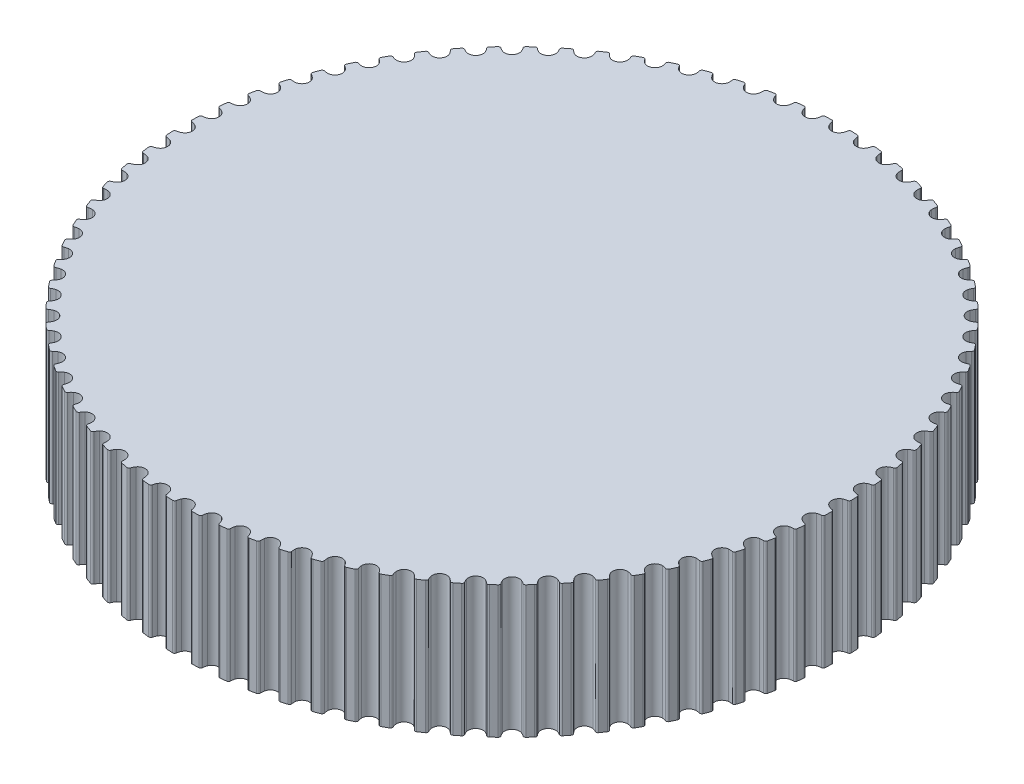
from build123d import *

# Parameters (mm, degrees)
BOSS_EXTRUDE1_DEPTH = 10
FILLET1_R           = 0.15
CIRPATTERN1_DEPTH   = 10


# Read off the part's stored shape, not the designer's step: CirPattern1
with BuildPart() as part:
    # Sketch1 → Boss-Extrude1 (new body)
    with BuildSketch(Plane(origin=(0, 0, 0), x_dir=(1, 0, 0), z_dir=(0, 1, 0))):
        with BuildLine():
            ThreePointArc((0.598433278, 24.949324036), (0.573292963, 24.73041549), (0.500820677, 24.522327156))
            ThreePointArc((0.500820677, 24.522327156), (-3.2e-08, 24.2065), (-0.500820704, 24.522327213))
            ThreePointArc((-0.500820704, 24.522327213), (-0.57329297, 24.730415521), (-0.598433278, 24.949324036))
            ThreePointArc((-0.598433278, 24.949324036), (0, -24.9565), (0.598433278, 24.949324036))
        make_face()
    extrude(amount=BOSS_EXTRUDE1_DEPTH)

    # Fillet1
    fillet1_edges = [part.edges().sort_by_distance(p)[0] for p in [
        (0.598433278, 5, -24.949324036),
        (-0.598433278, 5, -24.949324036),
    ]]
    fillet(fillet1_edges, radius=FILLET1_R)

    # CirPattern1 outline → CirPattern1 (cut)
    with BuildSketch(Plane(origin=(0, 0, 0), x_dir=(1, 0, 0), z_dir=(0, 1, 0))):
        with BuildLine():
            ThreePointArc((-1.217454276, 24.926786743), (-1.958064423, 24.879567439), (-2.696943156, 24.810348443))
            ThreePointArc((-2.696943156, 24.810348443), (-2.593188828, 24.783029865), (-2.53422328, 24.693395444))
            ThreePointArc((-2.53422328, 24.693395444), (-2.489778848, 24.546138198), (-2.423276455, 24.407439115))
            ThreePointArc((-2.423276455, 24.407439115), (-1.899220101, 24.131879439), (-1.42472278, 24.486026993))
            ThreePointArc((-1.42472278, 24.486026993), (-1.380736459, 24.633421727), (-1.35987532, 24.785818632))
            ThreePointArc((-1.35987532, 24.785818632), (-1.315657649, 24.883573749), (-1.217454276, 24.926786743))
        make_face()
        with BuildLine():
            ThreePointArc((-3.169434418, 24.754425417), (-3.904056726, 24.649244072), (-4.635226883, 24.522266698))
            ThreePointArc((-4.635226883, 24.522266698), (-4.529649004, 24.503172804), (-4.463832592, 24.41844108))
            ThreePointArc((-4.463832592, 24.41844108), (-4.407971497, 24.275124849), (-4.330791905, 24.142071046))
            ThreePointArc((-4.330791905, 24.142071046), (-3.786730878, 23.908477817), (-3.341482371, 24.298762283))
            ThreePointArc((-3.341482371, 24.298762283), (-3.309196103, 24.449153775), (-3.300356195, 24.602717637))
            ThreePointArc((-3.300356195, 24.602717637), (-3.26394461, 24.703640686), (-3.169434418, 24.754425417))
        make_face()
        with BuildLine():
            ThreePointArc((-5.101873943, 24.429444826), (-5.825979223, 24.266949918), (-6.544932896, 24.082997024))
            ThreePointArc((-6.544932896, 24.082997024), (-6.438182389, 24.072245535), (-6.365920892, 23.992938906))
            ThreePointArc((-6.365920892, 23.992938906), (-6.298987536, 23.854447283), (-6.211606582, 23.727859082))
            ThreePointArc((-6.211606582, 23.727859082), (-5.6508952, 23.537672478), (-5.237640612, 23.961687623))
            ThreePointArc((-5.237640612, 23.961687623), (-5.217253452, 24.114148659), (-5.220489277, 24.267932707))
            ThreePointArc((-5.220489277, 24.267932707), (-5.192108268, 24.371401464), (-5.101873943, 24.429444826))
        make_face()
        with BuildLine():
            ThreePointArc((-7.002858719, 23.953848585), (-7.71198262, 23.735041949), (-8.414287221, 23.495247664))
            ThreePointArc((-8.414287221, 23.495247664), (-8.307022238, 23.492904867), (-8.228761173, 23.419512286))
            ThreePointArc((-8.228761173, 23.419512286), (-8.151168223, 23.286699117), (-8.054124639, 23.167356975))
            ThreePointArc((-8.054124639, 23.167356975), (-7.480219874, 23.021749562), (-7.101507057, 23.476881191))
            ThreePointArc((-7.101507057, 23.476881191), (-7.093144699, 23.630471799), (-7.108436306, 23.783527902))
            ThreePointArc((-7.108436306, 23.783527902), (-7.088260851, 23.888904447), (-7.002858719, 23.953848585))
        make_face()
        with BuildLine():
            ThreePointArc((-8.860668541, 23.330568901), (-9.55043908, 23.056799553), (-10.231764667, 22.76264229))
            ThreePointArc((-10.231764667, 22.76264229), (-10.124646533, 22.768722629), (-10.040868405, 22.701696585))
            ThreePointArc((-10.040868405, 22.701696585), (-9.953094247, 22.575380707), (-9.846986339, 22.46402041))
            ThreePointArc((-9.846986339, 22.46402041), (-9.263426506, 22.363889904), (-8.92159035, 22.847331979))
            ThreePointArc((-8.92159035, 22.847331979), (-8.92530435, 23.001105222), (-8.952557462, 23.152489738))
            ThreePointArc((-8.952557462, 23.152489738), (-8.940711949, 23.25912439), (-8.860668541, 23.330568901))
        make_face()
        with BuildLine():
            ThreePointArc((-10.663849396, 22.563448502), (-11.330013907, 22.236404321), (-11.986159882, 21.889697657))
            ThreePointArc((-11.986159882, 21.889697657), (-11.879849015, 21.904163644), (-11.791070344, 21.843917375))
            ThreePointArc((-11.791070344, 21.843917375), (-11.693656135, 21.724877568), (-11.579138094, 21.622185688))
            ThreePointArc((-11.579138094, 21.622185688), (-10.989521032, 21.568149428), (-10.686669071, 22.076921368))
            ThreePointArc((-10.686669071, 22.076921368), (-10.702436532, 22.229929182), (-10.741483124, 22.378708776))
            ThreePointArc((-10.741483124, 22.378708776), (-10.738040585, 22.485944097), (-10.663849396, 22.563448502))
        make_face()
        with BuildLine():
            ThreePointArc((-12.401284073, 21.65721694), (-13.03973543, 21.278914262), (-13.666656435, 20.881795759))
            ThreePointArc((-13.666656435, 20.881795759), (-13.561808277, 20.904558207), (-13.468576414, 20.851463151))
            ThreePointArc((-13.468576414, 20.851463151), (-13.362122744, 20.740433335), (-13.239900613, 20.647043001))
            ThreePointArc((-13.239900613, 20.647043001), (-12.647861507, 20.639434138), (-12.385860924, 21.170399196))
            ThreePointArc((-12.385860924, 21.170399196), (-12.413584633, 21.321698237), (-12.46418397, 21.466955632))
            ThreePointArc((-12.46418397, 21.466955632), (-12.46916563, 21.574130482), (-12.401284073, 21.65721694))
        make_face()
        with BuildLine():
            ThreePointArc((-14.06226071, 20.617461434), (-14.669062649, 20.19023262), (-15.262893507, 19.745150646))
            ThreePointArc((-15.262893507, 19.745150646), (-15.160154482, 19.776069216), (-15.063044231, 19.730452723))
            ThreePointArc((-15.063044231, 19.730452723), (-14.948207424, 19.628117433), (-14.819034741, 19.544604429))
            ThreePointArc((-14.819034741, 19.544604429), (-14.22822371, 19.583469874), (-14.008689825, 20.133354472))
            ThreePointArc((-14.008689825, 20.133354472), (-14.048198858, 20.282011931), (-14.110038977, 20.422851569))
            ThreePointArc((-14.110038977, 20.422851569), (-14.123414123, 20.529305178), (-14.06226071, 20.617461434))
        make_face()
        with BuildLine():
            ThreePointArc((-15.636538834, 19.450592421), (-16.207950218, 18.97707148), (-16.765029765, 18.486770114))
            ThreePointArc((-16.765029765, 18.486770114), (-16.665033293, 18.525654183), (-16.564643372, 18.487797493))
            ThreePointArc((-16.564643372, 18.487797493), (-16.442131434, 18.39478766), (-16.306804592, 18.321666871))
            ThreePointArc((-16.306804592, 18.321666871), (-15.720864181, 18.406767006), (-15.545150495, 18.972180924))
            ThreePointArc((-15.545150495, 18.972180924), (-15.596201265, 19.117280279), (-15.668900903, 19.252833835))
            ThreePointArc((-15.668900903, 19.252833835), (-15.690587071, 19.357909881), (-15.636538834, 19.450592421))
        make_face()
        with BuildLine():
            ThreePointArc((-17.114412496, 18.163804039), (-17.646910385, 17.646910385), (-18.163804039, 17.114412496))
            ThreePointArc((-18.163804039, 17.114412496), (-18.067166631, 17.161022332), (-17.964115977, 17.131158843))
            ThreePointArc((-17.964115977, 17.131158843), (-17.834684236, 17.048047905), (-17.694037571, 16.985770144))
            ThreePointArc((-17.694037571, 16.985770144), (-17.116580299, 17.116580299), (-16.985770144, 17.694037571))
            ThreePointArc((-16.985770144, 17.694037571), (-17.048047905, 17.834684236), (-17.131158843, 17.964115977))
            ThreePointArc((-17.131158843, 17.964115977), (-17.161022332, 18.067166631), (-17.114412496, 18.163804039))
        make_face()
        with BuildLine():
            ThreePointArc((-18.486770114, 16.765029765), (-18.97707148, 16.207950218), (-19.450592421, 15.636538834))
            ThreePointArc((-19.450592421, 15.636538834), (-19.357909881, 15.690587071), (-19.252833835, 15.668900903))
            ThreePointArc((-19.252833835, 15.668900903), (-19.117280279, 15.596201265), (-18.972180924, 15.545150495))
            ThreePointArc((-18.972180924, 15.545150495), (-18.406767006, 15.720864181), (-18.321666871, 16.306804592))
            ThreePointArc((-18.321666871, 16.306804592), (-18.39478766, 16.442131434), (-18.487797493, 16.564643372))
            ThreePointArc((-18.487797493, 16.564643372), (-18.525654183, 16.665033293), (-18.486770114, 16.765029765))
        make_face()
        with BuildLine():
            ThreePointArc((-19.745150646, 15.262893507), (-20.19023262, 14.669062649), (-20.617461434, 14.06226071))
            ThreePointArc((-20.617461434, 14.06226071), (-20.529305178, 14.123414123), (-20.422851569, 14.110038977))
            ThreePointArc((-20.422851569, 14.110038977), (-20.282011931, 14.048198858), (-20.133354472, 14.008689825))
            ThreePointArc((-20.133354472, 14.008689825), (-19.583469874, 14.22822371), (-19.544604429, 14.819034741))
            ThreePointArc((-19.544604429, 14.819034741), (-19.628117433, 14.948207424), (-19.730452723, 15.063044231))
            ThreePointArc((-19.730452723, 15.063044231), (-19.776069216, 15.160154482), (-19.745150646, 15.262893507))
        make_face()
        with BuildLine():
            ThreePointArc((-20.881795759, 13.666656435), (-21.278914262, 13.03973543), (-21.65721694, 12.401284073))
            ThreePointArc((-21.65721694, 12.401284073), (-21.574130482, 12.46916563), (-21.466955632, 12.46418397))
            ThreePointArc((-21.466955632, 12.46418397), (-21.321698237, 12.413584633), (-21.170399196, 12.385860924))
            ThreePointArc((-21.170399196, 12.385860924), (-20.639434138, 12.647861507), (-20.647043001, 13.239900613))
            ThreePointArc((-20.647043001, 13.239900613), (-20.740433335, 13.362122744), (-20.851463151, 13.468576414))
            ThreePointArc((-20.851463151, 13.468576414), (-20.904558207, 13.561808277), (-20.881795759, 13.666656435))
        make_face()
        with BuildLine():
            ThreePointArc((-21.889697657, 11.986159882), (-22.236404321, 11.330013907), (-22.563448502, 10.663849396))
            ThreePointArc((-22.563448502, 10.663849396), (-22.485944097, 10.738040585), (-22.378708776, 10.741483124))
            ThreePointArc((-22.378708776, 10.741483124), (-22.229929182, 10.702436532), (-22.076921368, 10.686669071))
            ThreePointArc((-22.076921368, 10.686669071), (-21.568149428, 10.989521032), (-21.622185688, 11.579138094))
            ThreePointArc((-21.622185688, 11.579138094), (-21.724877568, 11.693656135), (-21.843917375, 11.791070344))
            ThreePointArc((-21.843917375, 11.791070344), (-21.904163644, 11.879849015), (-21.889697657, 11.986159882))
        make_face()
        with BuildLine():
            ThreePointArc((-22.76264229, 10.231764667), (-23.056799553, 9.55043908), (-23.330568901, 8.860668541))
            ThreePointArc((-23.330568901, 8.860668541), (-23.25912439, 8.940711949), (-23.152489738, 8.952557462))
            ThreePointArc((-23.152489738, 8.952557462), (-23.001105222, 8.92530435), (-22.847331979, 8.92159035))
            ThreePointArc((-22.847331979, 8.92159035), (-22.363889904, 9.263426506), (-22.46402041, 9.846986339))
            ThreePointArc((-22.46402041, 9.846986339), (-22.575380707, 9.953094247), (-22.701696585, 10.040868405))
            ThreePointArc((-22.701696585, 10.040868405), (-22.768722629, 10.124646533), (-22.76264229, 10.231764667))
        make_face()
        with BuildLine():
            ThreePointArc((-23.495247664, 8.414287221), (-23.735041949, 7.71198262), (-23.953848585, 7.002858719))
            ThreePointArc((-23.953848585, 7.002858719), (-23.888904447, 7.088260851), (-23.783527902, 7.108436306))
            ThreePointArc((-23.783527902, 7.108436306), (-23.630471799, 7.093144699), (-23.476881191, 7.101507057))
            ThreePointArc((-23.476881191, 7.101507057), (-23.021749562, 7.480219874), (-23.167356975, 8.054124639))
            ThreePointArc((-23.167356975, 8.054124639), (-23.286699117, 8.151168223), (-23.419512286, 8.228761173))
            ThreePointArc((-23.419512286, 8.228761173), (-23.492904867, 8.307022238), (-23.495247664, 8.414287221))
        make_face()
        with BuildLine():
            ThreePointArc((-24.082997024, 6.544932896), (-24.266949918, 5.825979223), (-24.429444826, 5.101873943))
            ThreePointArc((-24.429444826, 5.101873943), (-24.371401464, 5.192108268), (-24.267932707, 5.220489277))
            ThreePointArc((-24.267932707, 5.220489277), (-24.114148659, 5.217253452), (-23.961687623, 5.237640612))
            ThreePointArc((-23.961687623, 5.237640612), (-23.537672478, 5.6508952), (-23.727859082, 6.211606582))
            ThreePointArc((-23.727859082, 6.211606582), (-23.854447283, 6.298987536), (-23.992938906, 6.365920892))
            ThreePointArc((-23.992938906, 6.365920892), (-24.072245535, 6.438182389), (-24.082997024, 6.544932896))
        make_face()
        with BuildLine():
            ThreePointArc((-24.522266698, 4.635226883), (-24.649244072, 3.904056726), (-24.754425417, 3.169434418))
            ThreePointArc((-24.754425417, 3.169434418), (-24.703640686, 3.26394461), (-24.602717637, 3.300356195))
            ThreePointArc((-24.602717637, 3.300356195), (-24.449153775, 3.309196103), (-24.298762283, 3.341482371))
            ThreePointArc((-24.298762283, 3.341482371), (-23.908477817, 3.786730878), (-24.142071046, 4.330791905))
            ThreePointArc((-24.142071046, 4.330791905), (-24.275124849, 4.407971497), (-24.41844108, 4.463832592))
            ThreePointArc((-24.41844108, 4.463832592), (-24.503172804, 4.529649004), (-24.522266698, 4.635226883))
        make_face()
        with BuildLine():
            ThreePointArc((-24.810348443, 2.696943156), (-24.879567439, 1.958064423), (-24.926786743, 1.217454276))
            ThreePointArc((-24.926786743, 1.217454276), (-24.883573749, 1.315657649), (-24.785818632, 1.35987532))
            ThreePointArc((-24.785818632, 1.35987532), (-24.633421727, 1.380736459), (-24.486026993, 1.42472278))
            ThreePointArc((-24.486026993, 1.42472278), (-24.131879439, 1.899220101), (-24.407439115, 2.423276455))
            ThreePointArc((-24.407439115, 2.423276455), (-24.546138198, 2.489778848), (-24.693395444, 2.53422328))
            ThreePointArc((-24.693395444, 2.53422328), (-24.783029865, 2.593188828), (-24.810348443, 2.696943156))
        make_face()
        with BuildLine():
            ThreePointArc((-24.94546614, 0.742031876), (-24.9565, 0), (-24.94546614, -0.742031876))
            ThreePointArc((-24.94546614, -0.742031876), (-24.910091305, -0.640740779), (-24.816106813, -0.588989638))
            ThreePointArc((-24.816106813, -0.588989638), (-24.665816443, -0.556235884), (-24.522327205, -0.500820701))
            ThreePointArc((-24.522327205, -0.500820701), (-24.2065, 0), (-24.522327205, 0.500820701))
            ThreePointArc((-24.522327205, 0.500820701), (-24.665816443, 0.556235884), (-24.816106813, 0.588989638))
            ThreePointArc((-24.816106813, 0.588989638), (-24.910091305, 0.640740779), (-24.94546614, 0.742031876))
        make_face()
        with BuildLine():
            ThreePointArc((-24.926786743, -1.217454276), (-24.879567439, -1.958064423), (-24.810348443, -2.696943156))
            ThreePointArc((-24.810348443, -2.696943156), (-24.783029865, -2.593188828), (-24.693395444, -2.53422328))
            ThreePointArc((-24.693395444, -2.53422328), (-24.546138198, -2.489778848), (-24.407439115, -2.423276455))
            ThreePointArc((-24.407439115, -2.423276455), (-24.131879439, -1.899220101), (-24.486026993, -1.42472278))
            ThreePointArc((-24.486026993, -1.42472278), (-24.633421727, -1.380736459), (-24.785818632, -1.35987532))
            ThreePointArc((-24.785818632, -1.35987532), (-24.883573749, -1.315657649), (-24.926786743, -1.217454276))
        make_face()
        with BuildLine():
            ThreePointArc((-24.754425417, -3.169434418), (-24.649244072, -3.904056726), (-24.522266698, -4.635226883))
            ThreePointArc((-24.522266698, -4.635226883), (-24.503172804, -4.529649004), (-24.41844108, -4.463832592))
            ThreePointArc((-24.41844108, -4.463832592), (-24.275124849, -4.407971497), (-24.142071046, -4.330791905))
            ThreePointArc((-24.142071046, -4.330791905), (-23.908477817, -3.786730878), (-24.298762283, -3.341482371))
            ThreePointArc((-24.298762283, -3.341482371), (-24.449153775, -3.309196103), (-24.602717637, -3.300356195))
            ThreePointArc((-24.602717637, -3.300356195), (-24.703640686, -3.26394461), (-24.754425417, -3.169434418))
        make_face()
        with BuildLine():
            ThreePointArc((-24.429444826, -5.101873943), (-24.266949918, -5.825979223), (-24.082997024, -6.544932896))
            ThreePointArc((-24.082997024, -6.544932896), (-24.072245535, -6.438182389), (-23.992938906, -6.365920892))
            ThreePointArc((-23.992938906, -6.365920892), (-23.854447283, -6.298987536), (-23.727859082, -6.211606582))
            ThreePointArc((-23.727859082, -6.211606582), (-23.537672478, -5.6508952), (-23.961687623, -5.237640612))
            ThreePointArc((-23.961687623, -5.237640612), (-24.114148659, -5.217253452), (-24.267932707, -5.220489277))
            ThreePointArc((-24.267932707, -5.220489277), (-24.371401464, -5.192108268), (-24.429444826, -5.101873943))
        make_face()
        with BuildLine():
            ThreePointArc((-23.953848585, -7.002858719), (-23.735041949, -7.71198262), (-23.495247664, -8.414287221))
            ThreePointArc((-23.495247664, -8.414287221), (-23.492904867, -8.307022238), (-23.419512286, -8.228761173))
            ThreePointArc((-23.419512286, -8.228761173), (-23.286699117, -8.151168223), (-23.167356975, -8.054124639))
            ThreePointArc((-23.167356975, -8.054124639), (-23.021749562, -7.480219874), (-23.476881191, -7.101507057))
            ThreePointArc((-23.476881191, -7.101507057), (-23.630471799, -7.093144699), (-23.783527902, -7.108436306))
            ThreePointArc((-23.783527902, -7.108436306), (-23.888904447, -7.088260851), (-23.953848585, -7.002858719))
        make_face()
        with BuildLine():
            ThreePointArc((-23.330568901, -8.860668541), (-23.056799553, -9.55043908), (-22.76264229, -10.231764667))
            ThreePointArc((-22.76264229, -10.231764667), (-22.768722629, -10.124646533), (-22.701696585, -10.040868405))
            ThreePointArc((-22.701696585, -10.040868405), (-22.575380707, -9.953094247), (-22.46402041, -9.846986339))
            ThreePointArc((-22.46402041, -9.846986339), (-22.363889904, -9.263426506), (-22.847331979, -8.92159035))
            ThreePointArc((-22.847331979, -8.92159035), (-23.001105222, -8.92530435), (-23.152489738, -8.952557462))
            ThreePointArc((-23.152489738, -8.952557462), (-23.25912439, -8.940711949), (-23.330568901, -8.860668541))
        make_face()
        with BuildLine():
            ThreePointArc((-22.563448502, -10.663849396), (-22.236404321, -11.330013907), (-21.889697657, -11.986159882))
            ThreePointArc((-21.889697657, -11.986159882), (-21.904163644, -11.879849015), (-21.843917375, -11.791070344))
            ThreePointArc((-21.843917375, -11.791070344), (-21.724877568, -11.693656135), (-21.622185688, -11.579138094))
            ThreePointArc((-21.622185688, -11.579138094), (-21.568149428, -10.989521032), (-22.076921368, -10.686669071))
            ThreePointArc((-22.076921368, -10.686669071), (-22.229929182, -10.702436532), (-22.378708776, -10.741483124))
            ThreePointArc((-22.378708776, -10.741483124), (-22.485944097, -10.738040585), (-22.563448502, -10.663849396))
        make_face()
        with BuildLine():
            ThreePointArc((-21.65721694, -12.401284073), (-21.278914262, -13.03973543), (-20.881795759, -13.666656435))
            ThreePointArc((-20.881795759, -13.666656435), (-20.904558207, -13.561808277), (-20.851463151, -13.468576414))
            ThreePointArc((-20.851463151, -13.468576414), (-20.740433335, -13.362122744), (-20.647043001, -13.239900613))
            ThreePointArc((-20.647043001, -13.239900613), (-20.639434138, -12.647861507), (-21.170399196, -12.385860924))
            ThreePointArc((-21.170399196, -12.385860924), (-21.321698237, -12.413584633), (-21.466955632, -12.46418397))
            ThreePointArc((-21.466955632, -12.46418397), (-21.574130482, -12.46916563), (-21.65721694, -12.401284073))
        make_face()
        with BuildLine():
            ThreePointArc((-20.617461434, -14.06226071), (-20.19023262, -14.669062649), (-19.745150646, -15.262893507))
            ThreePointArc((-19.745150646, -15.262893507), (-19.776069216, -15.160154482), (-19.730452723, -15.063044231))
            ThreePointArc((-19.730452723, -15.063044231), (-19.628117433, -14.948207424), (-19.544604429, -14.819034741))
            ThreePointArc((-19.544604429, -14.819034741), (-19.583469874, -14.22822371), (-20.133354472, -14.008689825))
            ThreePointArc((-20.133354472, -14.008689825), (-20.282011931, -14.048198858), (-20.422851569, -14.110038977))
            ThreePointArc((-20.422851569, -14.110038977), (-20.529305178, -14.123414123), (-20.617461434, -14.06226071))
        make_face()
        with BuildLine():
            ThreePointArc((-19.450592421, -15.636538834), (-18.97707148, -16.207950218), (-18.486770114, -16.765029765))
            ThreePointArc((-18.486770114, -16.765029765), (-18.525654183, -16.665033293), (-18.487797493, -16.564643372))
            ThreePointArc((-18.487797493, -16.564643372), (-18.39478766, -16.442131434), (-18.321666871, -16.306804592))
            ThreePointArc((-18.321666871, -16.306804592), (-18.406767006, -15.720864181), (-18.972180924, -15.545150495))
            ThreePointArc((-18.972180924, -15.545150495), (-19.117280279, -15.596201265), (-19.252833835, -15.668900903))
            ThreePointArc((-19.252833835, -15.668900903), (-19.357909881, -15.690587071), (-19.450592421, -15.636538834))
        make_face()
        with BuildLine():
            ThreePointArc((-18.163804039, -17.114412496), (-17.646910385, -17.646910385), (-17.114412496, -18.163804039))
            ThreePointArc((-17.114412496, -18.163804039), (-17.161022332, -18.067166631), (-17.131158843, -17.964115977))
            ThreePointArc((-17.131158843, -17.964115977), (-17.048047905, -17.834684236), (-16.985770144, -17.694037571))
            ThreePointArc((-16.985770144, -17.694037571), (-17.116580299, -17.116580299), (-17.694037571, -16.985770144))
            ThreePointArc((-17.694037571, -16.985770144), (-17.834684236, -17.048047905), (-17.964115977, -17.131158843))
            ThreePointArc((-17.964115977, -17.131158843), (-18.067166631, -17.161022332), (-18.163804039, -17.114412496))
        make_face()
        with BuildLine():
            ThreePointArc((-16.765029765, -18.486770114), (-16.207950218, -18.97707148), (-15.636538834, -19.450592421))
            ThreePointArc((-15.636538834, -19.450592421), (-15.690587071, -19.357909881), (-15.668900903, -19.252833835))
            ThreePointArc((-15.668900903, -19.252833835), (-15.596201265, -19.117280279), (-15.545150495, -18.972180924))
            ThreePointArc((-15.545150495, -18.972180924), (-15.720864181, -18.406767006), (-16.306804592, -18.321666871))
            ThreePointArc((-16.306804592, -18.321666871), (-16.442131434, -18.39478766), (-16.564643372, -18.487797493))
            ThreePointArc((-16.564643372, -18.487797493), (-16.665033293, -18.525654183), (-16.765029765, -18.486770114))
        make_face()
        with BuildLine():
            ThreePointArc((-15.262893507, -19.745150646), (-14.669062649, -20.19023262), (-14.06226071, -20.617461434))
            ThreePointArc((-14.06226071, -20.617461434), (-14.123414123, -20.529305178), (-14.110038977, -20.422851569))
            ThreePointArc((-14.110038977, -20.422851569), (-14.048198858, -20.282011931), (-14.008689825, -20.133354472))
            ThreePointArc((-14.008689825, -20.133354472), (-14.22822371, -19.583469874), (-14.819034741, -19.544604429))
            ThreePointArc((-14.819034741, -19.544604429), (-14.948207424, -19.628117433), (-15.063044231, -19.730452723))
            ThreePointArc((-15.063044231, -19.730452723), (-15.160154482, -19.776069216), (-15.262893507, -19.745150646))
        make_face()
        with BuildLine():
            ThreePointArc((-13.666656435, -20.881795759), (-13.03973543, -21.278914262), (-12.401284073, -21.65721694))
            ThreePointArc((-12.401284073, -21.65721694), (-12.46916563, -21.574130482), (-12.46418397, -21.466955632))
            ThreePointArc((-12.46418397, -21.466955632), (-12.413584633, -21.321698237), (-12.385860924, -21.170399196))
            ThreePointArc((-12.385860924, -21.170399196), (-12.647861507, -20.639434138), (-13.239900613, -20.647043001))
            ThreePointArc((-13.239900613, -20.647043001), (-13.362122744, -20.740433335), (-13.468576414, -20.851463151))
            ThreePointArc((-13.468576414, -20.851463151), (-13.561808277, -20.904558207), (-13.666656435, -20.881795759))
        make_face()
        with BuildLine():
            ThreePointArc((-11.986159882, -21.889697657), (-11.330013907, -22.236404321), (-10.663849396, -22.563448502))
            ThreePointArc((-10.663849396, -22.563448502), (-10.738040585, -22.485944097), (-10.741483124, -22.378708776))
            ThreePointArc((-10.741483124, -22.378708776), (-10.702436532, -22.229929182), (-10.686669071, -22.076921368))
            ThreePointArc((-10.686669071, -22.076921368), (-10.989521032, -21.568149428), (-11.579138094, -21.622185688))
            ThreePointArc((-11.579138094, -21.622185688), (-11.693656135, -21.724877568), (-11.791070344, -21.843917375))
            ThreePointArc((-11.791070344, -21.843917375), (-11.879849015, -21.904163644), (-11.986159882, -21.889697657))
        make_face()
        with BuildLine():
            ThreePointArc((-10.231764667, -22.76264229), (-9.55043908, -23.056799553), (-8.860668541, -23.330568901))
            ThreePointArc((-8.860668541, -23.330568901), (-8.940711949, -23.25912439), (-8.952557462, -23.152489738))
            ThreePointArc((-8.952557462, -23.152489738), (-8.92530435, -23.001105222), (-8.92159035, -22.847331979))
            ThreePointArc((-8.92159035, -22.847331979), (-9.263426506, -22.363889904), (-9.846986339, -22.46402041))
            ThreePointArc((-9.846986339, -22.46402041), (-9.953094247, -22.575380707), (-10.040868405, -22.701696585))
            ThreePointArc((-10.040868405, -22.701696585), (-10.124646533, -22.768722629), (-10.231764667, -22.76264229))
        make_face()
        with BuildLine():
            ThreePointArc((-8.414287221, -23.495247664), (-7.71198262, -23.735041949), (-7.002858719, -23.953848585))
            ThreePointArc((-7.002858719, -23.953848585), (-7.088260851, -23.888904447), (-7.108436306, -23.783527902))
            ThreePointArc((-7.108436306, -23.783527902), (-7.093144699, -23.630471799), (-7.101507057, -23.476881191))
            ThreePointArc((-7.101507057, -23.476881191), (-7.480219874, -23.021749562), (-8.054124639, -23.167356975))
            ThreePointArc((-8.054124639, -23.167356975), (-8.151168223, -23.286699117), (-8.228761173, -23.419512286))
            ThreePointArc((-8.228761173, -23.419512286), (-8.307022238, -23.492904867), (-8.414287221, -23.495247664))
        make_face()
        with BuildLine():
            ThreePointArc((-6.544932896, -24.082997024), (-5.825979223, -24.266949918), (-5.101873943, -24.429444826))
            ThreePointArc((-5.101873943, -24.429444826), (-5.192108268, -24.371401464), (-5.220489277, -24.267932707))
            ThreePointArc((-5.220489277, -24.267932707), (-5.217253452, -24.114148659), (-5.237640612, -23.961687623))
            ThreePointArc((-5.237640612, -23.961687623), (-5.6508952, -23.537672478), (-6.211606582, -23.727859082))
            ThreePointArc((-6.211606582, -23.727859082), (-6.298987536, -23.854447283), (-6.365920892, -23.992938906))
            ThreePointArc((-6.365920892, -23.992938906), (-6.438182389, -24.072245535), (-6.544932896, -24.082997024))
        make_face()
        with BuildLine():
            ThreePointArc((-4.635226883, -24.522266698), (-3.904056726, -24.649244072), (-3.169434418, -24.754425417))
            ThreePointArc((-3.169434418, -24.754425417), (-3.26394461, -24.703640686), (-3.300356195, -24.602717637))
            ThreePointArc((-3.300356195, -24.602717637), (-3.309196103, -24.449153775), (-3.341482371, -24.298762283))
            ThreePointArc((-3.341482371, -24.298762283), (-3.786730878, -23.908477817), (-4.330791905, -24.142071046))
            ThreePointArc((-4.330791905, -24.142071046), (-4.407971497, -24.275124849), (-4.463832592, -24.41844108))
            ThreePointArc((-4.463832592, -24.41844108), (-4.529649004, -24.503172804), (-4.635226883, -24.522266698))
        make_face()
        with BuildLine():
            ThreePointArc((-2.696943156, -24.810348443), (-1.958064423, -24.879567439), (-1.217454276, -24.926786743))
            ThreePointArc((-1.217454276, -24.926786743), (-1.315657649, -24.883573749), (-1.35987532, -24.785818632))
            ThreePointArc((-1.35987532, -24.785818632), (-1.380736459, -24.633421727), (-1.42472278, -24.486026993))
            ThreePointArc((-1.42472278, -24.486026993), (-1.899220101, -24.131879439), (-2.423276455, -24.407439115))
            ThreePointArc((-2.423276455, -24.407439115), (-2.489778848, -24.546138198), (-2.53422328, -24.693395444))
            ThreePointArc((-2.53422328, -24.693395444), (-2.593188828, -24.783029865), (-2.696943156, -24.810348443))
        make_face()
        with BuildLine():
            ThreePointArc((-0.742031876, -24.94546614), (0, -24.9565), (0.742031876, -24.94546614))
            ThreePointArc((0.742031876, -24.94546614), (0.640740779, -24.910091305), (0.588989638, -24.816106813))
            ThreePointArc((0.588989638, -24.816106813), (0.556235884, -24.665816443), (0.500820701, -24.522327205))
            ThreePointArc((0.500820701, -24.522327205), (0, -24.2065), (-0.500820701, -24.522327205))
            ThreePointArc((-0.500820701, -24.522327205), (-0.556235884, -24.665816443), (-0.588989638, -24.816106813))
            ThreePointArc((-0.588989638, -24.816106813), (-0.640740779, -24.910091305), (-0.742031876, -24.94546614))
        make_face()
        with BuildLine():
            ThreePointArc((1.217454276, -24.926786743), (1.958064423, -24.879567439), (2.696943156, -24.810348443))
            ThreePointArc((2.696943156, -24.810348443), (2.593188828, -24.783029865), (2.53422328, -24.693395444))
            ThreePointArc((2.53422328, -24.693395444), (2.489778848, -24.546138198), (2.423276455, -24.407439115))
            ThreePointArc((2.423276455, -24.407439115), (1.899220101, -24.131879439), (1.42472278, -24.486026993))
            ThreePointArc((1.42472278, -24.486026993), (1.380736459, -24.633421727), (1.35987532, -24.785818632))
            ThreePointArc((1.35987532, -24.785818632), (1.315657649, -24.883573749), (1.217454276, -24.926786743))
        make_face()
        with BuildLine():
            ThreePointArc((3.169434418, -24.754425417), (3.904056726, -24.649244072), (4.635226883, -24.522266698))
            ThreePointArc((4.635226883, -24.522266698), (4.529649004, -24.503172804), (4.463832592, -24.41844108))
            ThreePointArc((4.463832592, -24.41844108), (4.407971497, -24.275124849), (4.330791905, -24.142071046))
            ThreePointArc((4.330791905, -24.142071046), (3.786730878, -23.908477817), (3.341482371, -24.298762283))
            ThreePointArc((3.341482371, -24.298762283), (3.309196103, -24.449153775), (3.300356195, -24.602717637))
            ThreePointArc((3.300356195, -24.602717637), (3.26394461, -24.703640686), (3.169434418, -24.754425417))
        make_face()
        with BuildLine():
            ThreePointArc((5.101873943, -24.429444826), (5.825979223, -24.266949918), (6.544932896, -24.082997024))
            ThreePointArc((6.544932896, -24.082997024), (6.438182389, -24.072245535), (6.365920892, -23.992938906))
            ThreePointArc((6.365920892, -23.992938906), (6.298987536, -23.854447283), (6.211606582, -23.727859082))
            ThreePointArc((6.211606582, -23.727859082), (5.6508952, -23.537672478), (5.237640612, -23.961687623))
            ThreePointArc((5.237640612, -23.961687623), (5.217253452, -24.114148659), (5.220489277, -24.267932707))
            ThreePointArc((5.220489277, -24.267932707), (5.192108268, -24.371401464), (5.101873943, -24.429444826))
        make_face()
        with BuildLine():
            ThreePointArc((7.002858719, -23.953848585), (7.71198262, -23.735041949), (8.414287221, -23.495247664))
            ThreePointArc((8.414287221, -23.495247664), (8.307022238, -23.492904867), (8.228761173, -23.419512286))
            ThreePointArc((8.228761173, -23.419512286), (8.151168223, -23.286699117), (8.054124639, -23.167356975))
            ThreePointArc((8.054124639, -23.167356975), (7.480219874, -23.021749562), (7.101507057, -23.476881191))
            ThreePointArc((7.101507057, -23.476881191), (7.093144699, -23.630471799), (7.108436306, -23.783527902))
            ThreePointArc((7.108436306, -23.783527902), (7.088260851, -23.888904447), (7.002858719, -23.953848585))
        make_face()
        with BuildLine():
            ThreePointArc((8.860668541, -23.330568901), (9.55043908, -23.056799553), (10.231764667, -22.76264229))
            ThreePointArc((10.231764667, -22.76264229), (10.124646533, -22.768722629), (10.040868405, -22.701696585))
            ThreePointArc((10.040868405, -22.701696585), (9.953094247, -22.575380707), (9.846986339, -22.46402041))
            ThreePointArc((9.846986339, -22.46402041), (9.263426506, -22.363889904), (8.92159035, -22.847331979))
            ThreePointArc((8.92159035, -22.847331979), (8.92530435, -23.001105222), (8.952557462, -23.152489738))
            ThreePointArc((8.952557462, -23.152489738), (8.940711949, -23.25912439), (8.860668541, -23.330568901))
        make_face()
        with BuildLine():
            ThreePointArc((10.663849396, -22.563448502), (11.330013907, -22.236404321), (11.986159882, -21.889697657))
            ThreePointArc((11.986159882, -21.889697657), (11.879849015, -21.904163644), (11.791070344, -21.843917375))
            ThreePointArc((11.791070344, -21.843917375), (11.693656135, -21.724877568), (11.579138094, -21.622185688))
            ThreePointArc((11.579138094, -21.622185688), (10.989521032, -21.568149428), (10.686669071, -22.076921368))
            ThreePointArc((10.686669071, -22.076921368), (10.702436532, -22.229929182), (10.741483124, -22.378708776))
            ThreePointArc((10.741483124, -22.378708776), (10.738040585, -22.485944097), (10.663849396, -22.563448502))
        make_face()
        with BuildLine():
            ThreePointArc((12.401284073, -21.65721694), (13.03973543, -21.278914262), (13.666656435, -20.881795759))
            ThreePointArc((13.666656435, -20.881795759), (13.561808277, -20.904558207), (13.468576414, -20.851463151))
            ThreePointArc((13.468576414, -20.851463151), (13.362122744, -20.740433335), (13.239900613, -20.647043001))
            ThreePointArc((13.239900613, -20.647043001), (12.647861507, -20.639434138), (12.385860924, -21.170399196))
            ThreePointArc((12.385860924, -21.170399196), (12.413584633, -21.321698237), (12.46418397, -21.466955632))
            ThreePointArc((12.46418397, -21.466955632), (12.46916563, -21.574130482), (12.401284073, -21.65721694))
        make_face()
        with BuildLine():
            ThreePointArc((14.06226071, -20.617461434), (14.669062649, -20.19023262), (15.262893507, -19.745150646))
            ThreePointArc((15.262893507, -19.745150646), (15.160154482, -19.776069216), (15.063044231, -19.730452723))
            ThreePointArc((15.063044231, -19.730452723), (14.948207424, -19.628117433), (14.819034741, -19.544604429))
            ThreePointArc((14.819034741, -19.544604429), (14.22822371, -19.583469874), (14.008689825, -20.133354472))
            ThreePointArc((14.008689825, -20.133354472), (14.048198858, -20.282011931), (14.110038977, -20.422851569))
            ThreePointArc((14.110038977, -20.422851569), (14.123414123, -20.529305178), (14.06226071, -20.617461434))
        make_face()
        with BuildLine():
            ThreePointArc((15.636538834, -19.450592421), (16.207950218, -18.97707148), (16.765029765, -18.486770114))
            ThreePointArc((16.765029765, -18.486770114), (16.665033293, -18.525654183), (16.564643372, -18.487797493))
            ThreePointArc((16.564643372, -18.487797493), (16.442131434, -18.39478766), (16.306804592, -18.321666871))
            ThreePointArc((16.306804592, -18.321666871), (15.720864181, -18.406767006), (15.545150495, -18.972180924))
            ThreePointArc((15.545150495, -18.972180924), (15.596201265, -19.117280279), (15.668900903, -19.252833835))
            ThreePointArc((15.668900903, -19.252833835), (15.690587071, -19.357909881), (15.636538834, -19.450592421))
        make_face()
        with BuildLine():
            ThreePointArc((17.114412496, -18.163804039), (17.646910385, -17.646910385), (18.163804039, -17.114412496))
            ThreePointArc((18.163804039, -17.114412496), (18.067166631, -17.161022332), (17.964115977, -17.131158843))
            ThreePointArc((17.964115977, -17.131158843), (17.834684236, -17.048047905), (17.694037571, -16.985770144))
            ThreePointArc((17.694037571, -16.985770144), (17.116580299, -17.116580299), (16.985770144, -17.694037571))
            ThreePointArc((16.985770144, -17.694037571), (17.048047905, -17.834684236), (17.131158843, -17.964115977))
            ThreePointArc((17.131158843, -17.964115977), (17.161022332, -18.067166631), (17.114412496, -18.163804039))
        make_face()
        with BuildLine():
            ThreePointArc((18.486770114, -16.765029765), (18.97707148, -16.207950218), (19.450592421, -15.636538834))
            ThreePointArc((19.450592421, -15.636538834), (19.357909881, -15.690587071), (19.252833835, -15.668900903))
            ThreePointArc((19.252833835, -15.668900903), (19.117280279, -15.596201265), (18.972180924, -15.545150495))
            ThreePointArc((18.972180924, -15.545150495), (18.406767006, -15.720864181), (18.321666871, -16.306804592))
            ThreePointArc((18.321666871, -16.306804592), (18.39478766, -16.442131434), (18.487797493, -16.564643372))
            ThreePointArc((18.487797493, -16.564643372), (18.525654183, -16.665033293), (18.486770114, -16.765029765))
        make_face()
        with BuildLine():
            ThreePointArc((19.745150646, -15.262893507), (20.19023262, -14.669062649), (20.617461434, -14.06226071))
            ThreePointArc((20.617461434, -14.06226071), (20.529305178, -14.123414123), (20.422851569, -14.110038977))
            ThreePointArc((20.422851569, -14.110038977), (20.282011931, -14.048198858), (20.133354472, -14.008689825))
            ThreePointArc((20.133354472, -14.008689825), (19.583469874, -14.22822371), (19.544604429, -14.819034741))
            ThreePointArc((19.544604429, -14.819034741), (19.628117433, -14.948207424), (19.730452723, -15.063044231))
            ThreePointArc((19.730452723, -15.063044231), (19.776069216, -15.160154482), (19.745150646, -15.262893507))
        make_face()
        with BuildLine():
            ThreePointArc((20.881795759, -13.666656435), (21.278914262, -13.03973543), (21.65721694, -12.401284073))
            ThreePointArc((21.65721694, -12.401284073), (21.574130482, -12.46916563), (21.466955632, -12.46418397))
            ThreePointArc((21.466955632, -12.46418397), (21.321698237, -12.413584633), (21.170399196, -12.385860924))
            ThreePointArc((21.170399196, -12.385860924), (20.639434138, -12.647861507), (20.647043001, -13.239900613))
            ThreePointArc((20.647043001, -13.239900613), (20.740433335, -13.362122744), (20.851463151, -13.468576414))
            ThreePointArc((20.851463151, -13.468576414), (20.904558207, -13.561808277), (20.881795759, -13.666656435))
        make_face()
        with BuildLine():
            ThreePointArc((21.889697657, -11.986159882), (22.236404321, -11.330013907), (22.563448502, -10.663849396))
            ThreePointArc((22.563448502, -10.663849396), (22.485944097, -10.738040585), (22.378708776, -10.741483124))
            ThreePointArc((22.378708776, -10.741483124), (22.229929182, -10.702436532), (22.076921368, -10.686669071))
            ThreePointArc((22.076921368, -10.686669071), (21.568149428, -10.989521032), (21.622185688, -11.579138094))
            ThreePointArc((21.622185688, -11.579138094), (21.724877568, -11.693656135), (21.843917375, -11.791070344))
            ThreePointArc((21.843917375, -11.791070344), (21.904163644, -11.879849015), (21.889697657, -11.986159882))
        make_face()
        with BuildLine():
            ThreePointArc((22.76264229, -10.231764667), (23.056799553, -9.55043908), (23.330568901, -8.860668541))
            ThreePointArc((23.330568901, -8.860668541), (23.25912439, -8.940711949), (23.152489738, -8.952557462))
            ThreePointArc((23.152489738, -8.952557462), (23.001105222, -8.92530435), (22.847331979, -8.92159035))
            ThreePointArc((22.847331979, -8.92159035), (22.363889904, -9.263426506), (22.46402041, -9.846986339))
            ThreePointArc((22.46402041, -9.846986339), (22.575380707, -9.953094247), (22.701696585, -10.040868405))
            ThreePointArc((22.701696585, -10.040868405), (22.768722629, -10.124646533), (22.76264229, -10.231764667))
        make_face()
        with BuildLine():
            ThreePointArc((23.495247664, -8.414287221), (23.735041949, -7.71198262), (23.953848585, -7.002858719))
            ThreePointArc((23.953848585, -7.002858719), (23.888904447, -7.088260851), (23.783527902, -7.108436306))
            ThreePointArc((23.783527902, -7.108436306), (23.630471799, -7.093144699), (23.476881191, -7.101507057))
            ThreePointArc((23.476881191, -7.101507057), (23.021749562, -7.480219874), (23.167356975, -8.054124639))
            ThreePointArc((23.167356975, -8.054124639), (23.286699117, -8.151168223), (23.419512286, -8.228761173))
            ThreePointArc((23.419512286, -8.228761173), (23.492904867, -8.307022238), (23.495247664, -8.414287221))
        make_face()
        with BuildLine():
            ThreePointArc((24.082997024, -6.544932896), (24.266949918, -5.825979223), (24.429444826, -5.101873943))
            ThreePointArc((24.429444826, -5.101873943), (24.371401464, -5.192108268), (24.267932707, -5.220489277))
            ThreePointArc((24.267932707, -5.220489277), (24.114148659, -5.217253452), (23.961687623, -5.237640612))
            ThreePointArc((23.961687623, -5.237640612), (23.537672478, -5.6508952), (23.727859082, -6.211606582))
            ThreePointArc((23.727859082, -6.211606582), (23.854447283, -6.298987536), (23.992938906, -6.365920892))
            ThreePointArc((23.992938906, -6.365920892), (24.072245535, -6.438182389), (24.082997024, -6.544932896))
        make_face()
        with BuildLine():
            ThreePointArc((24.522266698, -4.635226883), (24.649244072, -3.904056726), (24.754425417, -3.169434418))
            ThreePointArc((24.754425417, -3.169434418), (24.703640686, -3.26394461), (24.602717637, -3.300356195))
            ThreePointArc((24.602717637, -3.300356195), (24.449153775, -3.309196103), (24.298762283, -3.341482371))
            ThreePointArc((24.298762283, -3.341482371), (23.908477817, -3.786730878), (24.142071046, -4.330791905))
            ThreePointArc((24.142071046, -4.330791905), (24.275124849, -4.407971497), (24.41844108, -4.463832592))
            ThreePointArc((24.41844108, -4.463832592), (24.503172804, -4.529649004), (24.522266698, -4.635226883))
        make_face()
        with BuildLine():
            ThreePointArc((24.810348443, -2.696943156), (24.879567439, -1.958064423), (24.926786743, -1.217454276))
            ThreePointArc((24.926786743, -1.217454276), (24.883573749, -1.315657649), (24.785818632, -1.35987532))
            ThreePointArc((24.785818632, -1.35987532), (24.633421727, -1.380736459), (24.486026993, -1.42472278))
            ThreePointArc((24.486026993, -1.42472278), (24.131879439, -1.899220101), (24.407439115, -2.423276455))
            ThreePointArc((24.407439115, -2.423276455), (24.546138198, -2.489778848), (24.693395444, -2.53422328))
            ThreePointArc((24.693395444, -2.53422328), (24.783029865, -2.593188828), (24.810348443, -2.696943156))
        make_face()
        with BuildLine():
            ThreePointArc((24.94546614, -0.742031876), (24.9565, 0), (24.94546614, 0.742031876))
            ThreePointArc((24.94546614, 0.742031876), (24.910091305, 0.640740779), (24.816106813, 0.588989638))
            ThreePointArc((24.816106813, 0.588989638), (24.665816443, 0.556235884), (24.522327205, 0.500820701))
            ThreePointArc((24.522327205, 0.500820701), (24.2065, 0), (24.522327205, -0.500820701))
            ThreePointArc((24.522327205, -0.500820701), (24.665816443, -0.556235884), (24.816106813, -0.588989638))
            ThreePointArc((24.816106813, -0.588989638), (24.910091305, -0.640740779), (24.94546614, -0.742031876))
        make_face()
        with BuildLine():
            ThreePointArc((24.926786743, 1.217454276), (24.879567439, 1.958064423), (24.810348443, 2.696943156))
            ThreePointArc((24.810348443, 2.696943156), (24.783029865, 2.593188828), (24.693395444, 2.53422328))
            ThreePointArc((24.693395444, 2.53422328), (24.546138198, 2.489778848), (24.407439115, 2.423276455))
            ThreePointArc((24.407439115, 2.423276455), (24.131879439, 1.899220101), (24.486026993, 1.42472278))
            ThreePointArc((24.486026993, 1.42472278), (24.633421727, 1.380736459), (24.785818632, 1.35987532))
            ThreePointArc((24.785818632, 1.35987532), (24.883573749, 1.315657649), (24.926786743, 1.217454276))
        make_face()
        with BuildLine():
            ThreePointArc((24.754425417, 3.169434418), (24.649244072, 3.904056726), (24.522266698, 4.635226883))
            ThreePointArc((24.522266698, 4.635226883), (24.503172804, 4.529649004), (24.41844108, 4.463832592))
            ThreePointArc((24.41844108, 4.463832592), (24.275124849, 4.407971497), (24.142071046, 4.330791905))
            ThreePointArc((24.142071046, 4.330791905), (23.908477817, 3.786730878), (24.298762283, 3.341482371))
            ThreePointArc((24.298762283, 3.341482371), (24.449153775, 3.309196103), (24.602717637, 3.300356195))
            ThreePointArc((24.602717637, 3.300356195), (24.703640686, 3.26394461), (24.754425417, 3.169434418))
        make_face()
        with BuildLine():
            ThreePointArc((24.429444826, 5.101873943), (24.266949918, 5.825979223), (24.082997024, 6.544932896))
            ThreePointArc((24.082997024, 6.544932896), (24.072245535, 6.438182389), (23.992938906, 6.365920892))
            ThreePointArc((23.992938906, 6.365920892), (23.854447283, 6.298987536), (23.727859082, 6.211606582))
            ThreePointArc((23.727859082, 6.211606582), (23.537672478, 5.6508952), (23.961687623, 5.237640612))
            ThreePointArc((23.961687623, 5.237640612), (24.114148659, 5.217253452), (24.267932707, 5.220489277))
            ThreePointArc((24.267932707, 5.220489277), (24.371401464, 5.192108268), (24.429444826, 5.101873943))
        make_face()
        with BuildLine():
            ThreePointArc((23.953848585, 7.002858719), (23.735041949, 7.71198262), (23.495247664, 8.414287221))
            ThreePointArc((23.495247664, 8.414287221), (23.492904867, 8.307022238), (23.419512286, 8.228761173))
            ThreePointArc((23.419512286, 8.228761173), (23.286699117, 8.151168223), (23.167356975, 8.054124639))
            ThreePointArc((23.167356975, 8.054124639), (23.021749562, 7.480219874), (23.476881191, 7.101507057))
            ThreePointArc((23.476881191, 7.101507057), (23.630471799, 7.093144699), (23.783527902, 7.108436306))
            ThreePointArc((23.783527902, 7.108436306), (23.888904447, 7.088260851), (23.953848585, 7.002858719))
        make_face()
        with BuildLine():
            ThreePointArc((23.330568901, 8.860668541), (23.056799553, 9.55043908), (22.76264229, 10.231764667))
            ThreePointArc((22.76264229, 10.231764667), (22.768722629, 10.124646533), (22.701696585, 10.040868405))
            ThreePointArc((22.701696585, 10.040868405), (22.575380707, 9.953094247), (22.46402041, 9.846986339))
            ThreePointArc((22.46402041, 9.846986339), (22.363889904, 9.263426506), (22.847331979, 8.92159035))
            ThreePointArc((22.847331979, 8.92159035), (23.001105222, 8.92530435), (23.152489738, 8.952557462))
            ThreePointArc((23.152489738, 8.952557462), (23.25912439, 8.940711949), (23.330568901, 8.860668541))
        make_face()
        with BuildLine():
            ThreePointArc((22.563448502, 10.663849396), (22.236404321, 11.330013907), (21.889697657, 11.986159882))
            ThreePointArc((21.889697657, 11.986159882), (21.904163644, 11.879849015), (21.843917375, 11.791070344))
            ThreePointArc((21.843917375, 11.791070344), (21.724877568, 11.693656135), (21.622185688, 11.579138094))
            ThreePointArc((21.622185688, 11.579138094), (21.568149428, 10.989521032), (22.076921368, 10.686669071))
            ThreePointArc((22.076921368, 10.686669071), (22.229929182, 10.702436532), (22.378708776, 10.741483124))
            ThreePointArc((22.378708776, 10.741483124), (22.485944097, 10.738040585), (22.563448502, 10.663849396))
        make_face()
        with BuildLine():
            ThreePointArc((21.65721694, 12.401284073), (21.278914262, 13.03973543), (20.881795759, 13.666656435))
            ThreePointArc((20.881795759, 13.666656435), (20.904558207, 13.561808277), (20.851463151, 13.468576414))
            ThreePointArc((20.851463151, 13.468576414), (20.740433335, 13.362122744), (20.647043001, 13.239900613))
            ThreePointArc((20.647043001, 13.239900613), (20.639434138, 12.647861507), (21.170399196, 12.385860924))
            ThreePointArc((21.170399196, 12.385860924), (21.321698237, 12.413584633), (21.466955632, 12.46418397))
            ThreePointArc((21.466955632, 12.46418397), (21.574130482, 12.46916563), (21.65721694, 12.401284073))
        make_face()
        with BuildLine():
            ThreePointArc((20.617461434, 14.06226071), (20.19023262, 14.669062649), (19.745150646, 15.262893507))
            ThreePointArc((19.745150646, 15.262893507), (19.776069216, 15.160154482), (19.730452723, 15.063044231))
            ThreePointArc((19.730452723, 15.063044231), (19.628117433, 14.948207424), (19.544604429, 14.819034741))
            ThreePointArc((19.544604429, 14.819034741), (19.583469874, 14.22822371), (20.133354472, 14.008689825))
            ThreePointArc((20.133354472, 14.008689825), (20.282011931, 14.048198858), (20.422851569, 14.110038977))
            ThreePointArc((20.422851569, 14.110038977), (20.529305178, 14.123414123), (20.617461434, 14.06226071))
        make_face()
        with BuildLine():
            ThreePointArc((19.450592421, 15.636538834), (18.97707148, 16.207950218), (18.486770114, 16.765029765))
            ThreePointArc((18.486770114, 16.765029765), (18.525654183, 16.665033293), (18.487797493, 16.564643372))
            ThreePointArc((18.487797493, 16.564643372), (18.39478766, 16.442131434), (18.321666871, 16.306804592))
            ThreePointArc((18.321666871, 16.306804592), (18.406767006, 15.720864181), (18.972180924, 15.545150495))
            ThreePointArc((18.972180924, 15.545150495), (19.117280279, 15.596201265), (19.252833835, 15.668900903))
            ThreePointArc((19.252833835, 15.668900903), (19.357909881, 15.690587071), (19.450592421, 15.636538834))
        make_face()
        with BuildLine():
            ThreePointArc((18.163804039, 17.114412496), (17.646910385, 17.646910385), (17.114412496, 18.163804039))
            ThreePointArc((17.114412496, 18.163804039), (17.161022332, 18.067166631), (17.131158843, 17.964115977))
            ThreePointArc((17.131158843, 17.964115977), (17.048047905, 17.834684236), (16.985770144, 17.694037571))
            ThreePointArc((16.985770144, 17.694037571), (17.116580299, 17.116580299), (17.694037571, 16.985770144))
            ThreePointArc((17.694037571, 16.985770144), (17.834684236, 17.048047905), (17.964115977, 17.131158843))
            ThreePointArc((17.964115977, 17.131158843), (18.067166631, 17.161022332), (18.163804039, 17.114412496))
        make_face()
        with BuildLine():
            ThreePointArc((16.765029765, 18.486770114), (16.207950218, 18.97707148), (15.636538834, 19.450592421))
            ThreePointArc((15.636538834, 19.450592421), (15.690587071, 19.357909881), (15.668900903, 19.252833835))
            ThreePointArc((15.668900903, 19.252833835), (15.596201265, 19.117280279), (15.545150495, 18.972180924))
            ThreePointArc((15.545150495, 18.972180924), (15.720864181, 18.406767006), (16.306804592, 18.321666871))
            ThreePointArc((16.306804592, 18.321666871), (16.442131434, 18.39478766), (16.564643372, 18.487797493))
            ThreePointArc((16.564643372, 18.487797493), (16.665033293, 18.525654183), (16.765029765, 18.486770114))
        make_face()
        with BuildLine():
            ThreePointArc((15.262893507, 19.745150646), (14.669062649, 20.19023262), (14.06226071, 20.617461434))
            ThreePointArc((14.06226071, 20.617461434), (14.123414123, 20.529305178), (14.110038977, 20.422851569))
            ThreePointArc((14.110038977, 20.422851569), (14.048198858, 20.282011931), (14.008689825, 20.133354472))
            ThreePointArc((14.008689825, 20.133354472), (14.22822371, 19.583469874), (14.819034741, 19.544604429))
            ThreePointArc((14.819034741, 19.544604429), (14.948207424, 19.628117433), (15.063044231, 19.730452723))
            ThreePointArc((15.063044231, 19.730452723), (15.160154482, 19.776069216), (15.262893507, 19.745150646))
        make_face()
        with BuildLine():
            ThreePointArc((13.666656435, 20.881795759), (13.03973543, 21.278914262), (12.401284073, 21.65721694))
            ThreePointArc((12.401284073, 21.65721694), (12.46916563, 21.574130482), (12.46418397, 21.466955632))
            ThreePointArc((12.46418397, 21.466955632), (12.413584633, 21.321698237), (12.385860924, 21.170399196))
            ThreePointArc((12.385860924, 21.170399196), (12.647861507, 20.639434138), (13.239900613, 20.647043001))
            ThreePointArc((13.239900613, 20.647043001), (13.362122744, 20.740433335), (13.468576414, 20.851463151))
            ThreePointArc((13.468576414, 20.851463151), (13.561808277, 20.904558207), (13.666656435, 20.881795759))
        make_face()
        with BuildLine():
            ThreePointArc((11.986159882, 21.889697657), (11.330013907, 22.236404321), (10.663849396, 22.563448502))
            ThreePointArc((10.663849396, 22.563448502), (10.738040585, 22.485944097), (10.741483124, 22.378708776))
            ThreePointArc((10.741483124, 22.378708776), (10.702436532, 22.229929182), (10.686669071, 22.076921368))
            ThreePointArc((10.686669071, 22.076921368), (10.989521032, 21.568149428), (11.579138094, 21.622185688))
            ThreePointArc((11.579138094, 21.622185688), (11.693656135, 21.724877568), (11.791070344, 21.843917375))
            ThreePointArc((11.791070344, 21.843917375), (11.879849015, 21.904163644), (11.986159882, 21.889697657))
        make_face()
        with BuildLine():
            ThreePointArc((10.231764667, 22.76264229), (9.55043908, 23.056799553), (8.860668541, 23.330568901))
            ThreePointArc((8.860668541, 23.330568901), (8.940711949, 23.25912439), (8.952557462, 23.152489738))
            ThreePointArc((8.952557462, 23.152489738), (8.92530435, 23.001105222), (8.92159035, 22.847331979))
            ThreePointArc((8.92159035, 22.847331979), (9.263426506, 22.363889904), (9.846986339, 22.46402041))
            ThreePointArc((9.846986339, 22.46402041), (9.953094247, 22.575380707), (10.040868405, 22.701696585))
            ThreePointArc((10.040868405, 22.701696585), (10.124646533, 22.768722629), (10.231764667, 22.76264229))
        make_face()
        with BuildLine():
            ThreePointArc((8.414287221, 23.495247664), (7.71198262, 23.735041949), (7.002858719, 23.953848585))
            ThreePointArc((7.002858719, 23.953848585), (7.088260851, 23.888904447), (7.108436306, 23.783527902))
            ThreePointArc((7.108436306, 23.783527902), (7.093144699, 23.630471799), (7.101507057, 23.476881191))
            ThreePointArc((7.101507057, 23.476881191), (7.480219874, 23.021749562), (8.054124639, 23.167356975))
            ThreePointArc((8.054124639, 23.167356975), (8.151168223, 23.286699117), (8.228761173, 23.419512286))
            ThreePointArc((8.228761173, 23.419512286), (8.307022238, 23.492904867), (8.414287221, 23.495247664))
        make_face()
        with BuildLine():
            ThreePointArc((6.544932896, 24.082997024), (5.825979223, 24.266949918), (5.101873943, 24.429444826))
            ThreePointArc((5.101873943, 24.429444826), (5.192108268, 24.371401464), (5.220489277, 24.267932707))
            ThreePointArc((5.220489277, 24.267932707), (5.217253452, 24.114148659), (5.237640612, 23.961687623))
            ThreePointArc((5.237640612, 23.961687623), (5.6508952, 23.537672478), (6.211606582, 23.727859082))
            ThreePointArc((6.211606582, 23.727859082), (6.298987536, 23.854447283), (6.365920892, 23.992938906))
            ThreePointArc((6.365920892, 23.992938906), (6.438182389, 24.072245535), (6.544932896, 24.082997024))
        make_face()
        with BuildLine():
            ThreePointArc((4.635226883, 24.522266698), (3.904056726, 24.649244072), (3.169434418, 24.754425417))
            ThreePointArc((3.169434418, 24.754425417), (3.26394461, 24.703640686), (3.300356195, 24.602717637))
            ThreePointArc((3.300356195, 24.602717637), (3.309196103, 24.449153775), (3.341482371, 24.298762283))
            ThreePointArc((3.341482371, 24.298762283), (3.786730878, 23.908477817), (4.330791905, 24.142071046))
            ThreePointArc((4.330791905, 24.142071046), (4.407971497, 24.275124849), (4.463832592, 24.41844108))
            ThreePointArc((4.463832592, 24.41844108), (4.529649004, 24.503172804), (4.635226883, 24.522266698))
        make_face()
        with BuildLine():
            ThreePointArc((1.217454276, 24.926786743), (1.315657649, 24.883573749), (1.35987532, 24.785818632))
            ThreePointArc((1.35987532, 24.785818632), (1.380736459, 24.633421727), (1.42472278, 24.486026993))
            ThreePointArc((1.42472278, 24.486026993), (1.899220101, 24.131879439), (2.423276455, 24.407439115))
            ThreePointArc((2.423276455, 24.407439115), (2.489778848, 24.546138198), (2.53422328, 24.693395444))
            ThreePointArc((2.53422328, 24.693395444), (2.593188828, 24.783029865), (2.696943156, 24.810348443))
            ThreePointArc((2.696943156, 24.810348443), (1.958064423, 24.879567439), (1.217454276, 24.926786743))
        make_face()
    extrude(amount=CIRPATTERN1_DEPTH, mode=Mode.SUBTRACT)


solid = part.part
